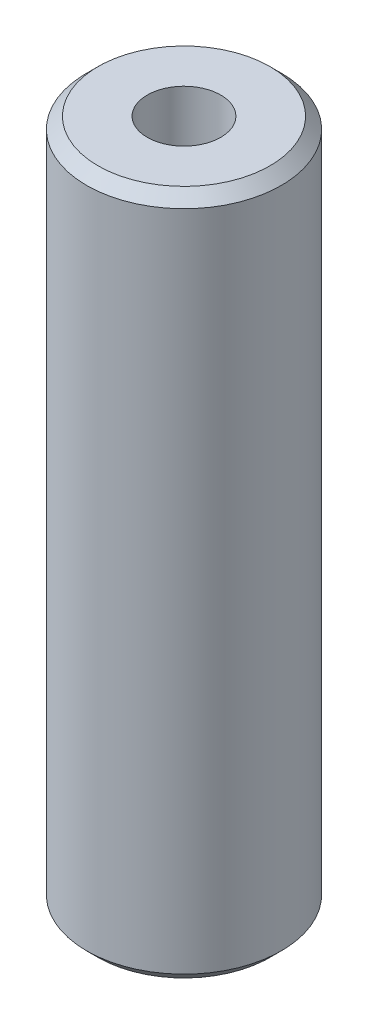
from build123d import *

# Parameters (mm, degrees)
SKETCH1_R           = 12.5
BOSS_EXTRUDE1_DEPTH = 88.041781688
SKETCH2_R           = 4.716534904
CUT_EXTRUDE1_DEPTH  = 90.798971725
CHAMFER1_SIZE       = 1.456117934


with BuildPart() as part:
    # Sketch1 → Boss-Extrude1 (new body)
    with BuildSketch(Plane(origin=(0, 0, 0), x_dir=(1, 0, 0), z_dir=(0, 1, 0))):
        Circle(SKETCH1_R)
    extrude(amount=BOSS_EXTRUDE1_DEPTH)

    # Sketch2 → Cut-Extrude1 (cut, through all)
    with BuildSketch(Plane(origin=(0, 0, 0), x_dir=(1, 0, 0), z_dir=(0, 1, 0))):
        Circle(SKETCH2_R)
    extrude(amount=CUT_EXTRUDE1_DEPTH, mode=Mode.SUBTRACT)

    # Chamfer1
    chamfer1_edges = [part.edges().sort_by_distance(p)[0] for p in [
        (-12.5, 88.041781688, 0),
        (-12.5, 0, 0),
    ]]
    chamfer(chamfer1_edges, length=CHAMFER1_SIZE)


solid = part.part
